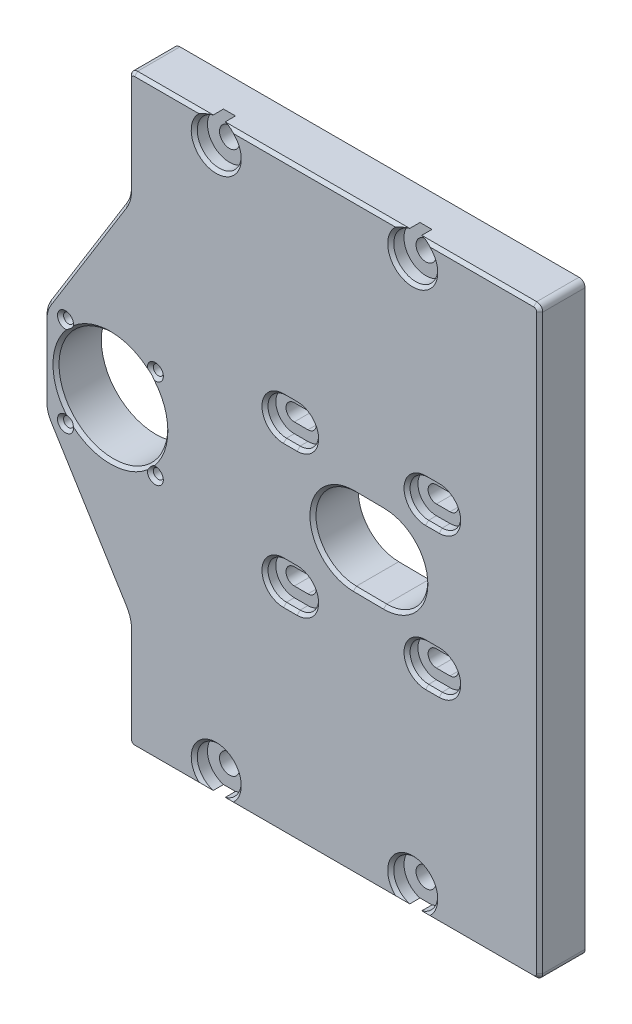
from build123d import *

# Parameters (mm, degrees)
SKETCH1_R                                = 18
BOSS_EXTRUDE1_DEPTH                      = 15
M4X0_7_TAPPED_HOLE1_D                    = 3.3
M4X0_7_TAPPED_HOLE1_DEPTH                = 19.008579979
M4X0_7_TAPPED_HOLE1_TIP                  = 0.991420021
CBORE_FOR_M6_HEX_HEAD_BOLT1_D            = 6.6
CBORE_FOR_M6_HEX_HEAD_BOLT1_DEPTH        = 28
CBORE_FOR_M6_HEX_HEAD_BOLT1_CBORE_D      = 14.55
CBORE_FOR_M6_HEX_HEAD_BOLT1_CBORE_DEPTH  = 4.38
CBORE_FOR_M6_HEX_HEAD_BOLT1_TIP          = 1.982840043
F_1_0MM_DOWEL_SLOT1_DEPTH                = 15
CBORE_SLOT_FOR_M5_HEX_HEAD_BOLT1_DEPTH   = 15
CBORE_START                              = 11.42
CBORE_SLOT_FOR_M5_HEX_HEAD_BOLT1_2_DEPTH = 3.58
FILLET1_R                                = 10
FILLET2_R                                = 2
CHAMFER1_SIZE                            = 1


# Read off the part's stored shape, not the designer's step: Ø1.0mm Dowel Slot1, CBORE SLOT for M5 Hex Head Bolt1
with BuildPart() as part:
    # Sketch1 → Boss-Extrude1 (new body)
    with BuildSketch(Plane.XY):
        Polygon((-148, 227), (-148, 190), (-176, 144.773286703), (-176, 115.226713297), (-148, 70), (-148, 33.5), (-12, 33.5), (-12, 227), align=None)
        with Locations((-154, 130)):
            Circle(SKETCH1_R, mode=Mode.SUBTRACT)
    extrude(amount=BOSS_EXTRUDE1_DEPTH)

    # M4x0.7 Tapped Hole1
    with Locations(Plane.XY.offset(15)):
        with Locations((-168.849242405, 144.849242405), (-139.150757595, 144.849242405), (-139.150757595, 115.150757595), (-168.849242405, 115.150757595)):
            Hole(M4X0_7_TAPPED_HOLE1_D / 2, depth=M4X0_7_TAPPED_HOLE1_DEPTH)
            with Locations((0, 0, -(M4X0_7_TAPPED_HOLE1_DEPTH + M4X0_7_TAPPED_HOLE1_TIP / 2))):  # 118° drill point
                Cone(0, M4X0_7_TAPPED_HOLE1_D / 2, M4X0_7_TAPPED_HOLE1_TIP, mode=Mode.SUBTRACT)

    # CBORE for M6 Hex Head Bolt1
    with Locations(Plane.XY.offset(15)):
        with Locations((-54, 220), (-119, 220), (-54, 40.5), (-119, 40.5)):
            CounterBoreHole(CBORE_FOR_M6_HEX_HEAD_BOLT1_D / 2, CBORE_FOR_M6_HEX_HEAD_BOLT1_CBORE_D / 2, CBORE_FOR_M6_HEX_HEAD_BOLT1_CBORE_DEPTH, depth=CBORE_FOR_M6_HEX_HEAD_BOLT1_DEPTH)
            with Locations((0, 0, -(CBORE_FOR_M6_HEX_HEAD_BOLT1_DEPTH + CBORE_FOR_M6_HEX_HEAD_BOLT1_TIP / 2))):  # 118° drill point
                Cone(0, CBORE_FOR_M6_HEX_HEAD_BOLT1_D / 2, CBORE_FOR_M6_HEX_HEAD_BOLT1_TIP, mode=Mode.SUBTRACT)

    # Ø1.0mm Dowel Slot1 outline → Ø1.0mm Dowel Slot1 (cut)
    with BuildSketch(Plane.XY):
        with BuildLine():
            Line((-73.630669903, 115.693008794), (-63.631140041, 115.596042148))
            ThreePointArc((-63.631140041, 115.596042148), (-50.000869755, 128.964502491), (-63.369330097, 142.594772777))
            Line((-63.369330097, 142.594772777), (-73.368859959, 142.691739423))
            ThreePointArc((-73.368859959, 142.691739423), (-86.999130245, 129.32327908), (-73.630669903, 115.693008794))
        make_face()
    extrude(amount=F_1_0MM_DOWEL_SLOT1_DEPTH, mode=Mode.SUBTRACT)

    # CBORE SLOT for M5 Hex Head Bolt1 outline → CBORE SLOT for M5 Hex Head Bolt1 (cut)
    with BuildSketch(Plane.XY):
        with BuildLine():
            Line((-49.75, 102.893890786), (-45.25, 102.893890786))
            ThreePointArc((-45.25, 102.893890786), (-42.5, 105.643890786), (-45.25, 108.393890786))
            Line((-45.25, 108.393890786), (-49.75, 108.393890786))
            ThreePointArc((-49.75, 108.393890786), (-52.5, 105.643890786), (-49.75, 102.893890786))
        make_face()
        with BuildLine():
            ThreePointArc((-92.25, 102.893890786), (-89.5, 105.643890786), (-92.25, 108.393890786))
            Line((-92.25, 108.393890786), (-96.75, 108.393890786))
            ThreePointArc((-96.75, 108.393890786), (-99.5, 105.643890786), (-96.75, 102.893890786))
            Line((-96.75, 102.893890786), (-92.25, 102.893890786))
        make_face()
        with BuildLine():
            Line((-49.75, 149.893890786), (-45.25, 149.893890786))
            ThreePointArc((-45.25, 149.893890786), (-42.5, 152.643890786), (-45.25, 155.393890786))
            Line((-45.25, 155.393890786), (-49.75, 155.393890786))
            ThreePointArc((-49.75, 155.393890786), (-52.5, 152.643890786), (-49.75, 149.893890786))
        make_face()
        with BuildLine():
            ThreePointArc((-92.25, 149.893890786), (-89.5, 152.643890786), (-92.25, 155.393890786))
            Line((-92.25, 155.393890786), (-96.75, 155.393890786))
            ThreePointArc((-96.75, 155.393890786), (-99.5, 152.643890786), (-96.75, 149.893890786))
            Line((-96.75, 149.893890786), (-92.25, 149.893890786))
        make_face()
    extrude(amount=CBORE_SLOT_FOR_M5_HEX_HEAD_BOLT1_DEPTH, mode=Mode.SUBTRACT)

    # CBORE SLOT for M5 Hex Head Bolt1 2 outli → CBORE SLOT for M5 Hex Head Bolt1 2 (cut)
    # profile 1 of 4: a face of its own
    with BuildSketch(Plane.XY.offset(CBORE_START)):
        with BuildLine():
            Line((-49.75, 99.523890786), (-45.25, 99.523890786))
            ThreePointArc((-45.25, 99.523890786), (-39.13, 105.643890786), (-45.25, 111.763890786))
            Line((-45.25, 111.763890786), (-49.75, 111.763890786))
            ThreePointArc((-49.75, 111.763890786), (-55.87, 105.643890786), (-49.75, 99.523890786))
        make_face()
        with BuildLine():
            ThreePointArc((-45.25, 108.393890786), (-42.5, 105.643890786), (-45.25, 102.893890786))
            Line((-45.25, 102.893890786), (-49.75, 102.893890786))
            ThreePointArc((-49.75, 102.893890786), (-52.5, 105.643890786), (-49.75, 108.393890786))
            Line((-49.75, 108.393890786), (-45.25, 108.393890786))
        make_face(mode=Mode.SUBTRACT)
    # profile 2 of 4: a face of its own
    with BuildSketch(Plane.XY.offset(CBORE_START)):
        with BuildLine():
            ThreePointArc((-92.25, 99.523890786), (-86.13, 105.643890786), (-92.25, 111.763890786))
            Line((-92.25, 111.763890786), (-96.75, 111.763890786))
            ThreePointArc((-96.75, 111.763890786), (-102.87, 105.643890786), (-96.75, 99.523890786))
            Line((-96.75, 99.523890786), (-92.25, 99.523890786))
        make_face()
        with BuildLine():
            Line((-96.75, 108.393890786), (-92.25, 108.393890786))
            ThreePointArc((-92.25, 108.393890786), (-89.5, 105.643890786), (-92.25, 102.893890786))
            Line((-92.25, 102.893890786), (-96.75, 102.893890786))
            ThreePointArc((-96.75, 102.893890786), (-99.5, 105.643890786), (-96.75, 108.393890786))
        make_face(mode=Mode.SUBTRACT)
    # profile 3 of 4: a face of its own
    with BuildSketch(Plane.XY.offset(CBORE_START)):
        with BuildLine():
            Line((-49.75, 146.523890786), (-45.25, 146.523890786))
            ThreePointArc((-45.25, 146.523890786), (-39.13, 152.643890786), (-45.25, 158.763890786))
            Line((-45.25, 158.763890786), (-49.75, 158.763890786))
            ThreePointArc((-49.75, 158.763890786), (-55.87, 152.643890786), (-49.75, 146.523890786))
        make_face()
        with BuildLine():
            ThreePointArc((-45.25, 155.393890786), (-42.5, 152.643890786), (-45.25, 149.893890786))
            Line((-45.25, 149.893890786), (-49.75, 149.893890786))
            ThreePointArc((-49.75, 149.893890786), (-52.5, 152.643890786), (-49.75, 155.393890786))
            Line((-49.75, 155.393890786), (-45.25, 155.393890786))
        make_face(mode=Mode.SUBTRACT)
    # profile 4 of 4: a face of its own
    with BuildSketch(Plane.XY.offset(CBORE_START)):
        with BuildLine():
            ThreePointArc((-92.25, 146.523890786), (-86.13, 152.643890786), (-92.25, 158.763890786))
            Line((-92.25, 158.763890786), (-96.75, 158.763890786))
            ThreePointArc((-96.75, 158.763890786), (-102.87, 152.643890786), (-96.75, 146.523890786))
            Line((-96.75, 146.523890786), (-92.25, 146.523890786))
        make_face()
        with BuildLine():
            Line((-96.75, 155.393890786), (-92.25, 155.393890786))
            ThreePointArc((-92.25, 155.393890786), (-89.5, 152.643890786), (-92.25, 149.893890786))
            Line((-92.25, 149.893890786), (-96.75, 149.893890786))
            ThreePointArc((-96.75, 149.893890786), (-99.5, 152.643890786), (-96.75, 155.393890786))
        make_face(mode=Mode.SUBTRACT)
    extrude(amount=CBORE_SLOT_FOR_M5_HEX_HEAD_BOLT1_2_DEPTH, mode=Mode.SUBTRACT)

    # Fillet1
    fillet1_edges = [part.edges().sort_by_distance(p)[0] for p in [
        (-148, 190, 7.5),
        (-148, 70, 7.5),
        (-176, 115.226713297, 7.5),
        (-176, 144.773286703, 7.5),
    ]]
    fillet(fillet1_edges, radius=FILLET1_R)

    # Fillet2
    fillet2_edges = [part.edges().sort_by_distance(p)[0] for p in [
        (-148, 227, 7.5),
        (-12, 227, 7.5),
        (-12, 33.5, 7.5),
        (-148, 33.5, 7.5),
    ]]
    fillet(fillet2_edges, radius=FILLET2_R)

    # Chamfer1
    # the kernel refuses this chamfer: 1 mm, written as the material it takes off along each edge
    with BuildSketch(Plane(origin=(-73.630669903, 115.693008794, 15), x_dir=(-0.009692998455511356, -0.9995749209290702, 0.027495876610585872), z_dir=(0.9999529862426669, -0.0096966646004136, 0)), Plane(origin=(-63.369330097, 142.594772777, 15), x_dir=(0.009692998455511349, 0.9995749209290702, 0.02749587661058549), z_dir=(-0.9999529862426669, 0.009696664600413593, 0))) as chamfer1_piece_1:
        Polygon((CHAMFER1_SIZE * 0.999621916911, CHAMFER1_SIZE * 0.0274958766106), (-CHAMFER1_SIZE * 0.0274958766106, CHAMFER1_SIZE * 0.999621916911), (0, 0), align=None)
    extrude(amount=10, mode=Mode.SUBTRACT)
    with BuildSketch(Plane(origin=(-63.50023507, 129.095407463, 15), x_dir=(-0.009696664555040242, -0.9999529862431069, 0), z_dir=(-0.9999529862431069, 0.009696664555040242, 0))) as chamfer1_piece_2:
        Polygon((13.5 + CHAMFER1_SIZE, 0), (13.5, -CHAMFER1_SIZE), (13.5, 0), align=None)
    revolve(axis=Axis((-63.50023507, 129.095407463, 15), (0, 0, 1)), revolution_arc=179.999999996, mode=Mode.SUBTRACT)
    with BuildSketch(Plane(origin=(-73.49976493, 129.192374108, 15), x_dir=(0.00969666455504077, 0.9999529862431069, 0), z_dir=(0.9999529862431069, -0.00969666455504077, 0))) as chamfer1_piece_3:
        Polygon((13.5 + CHAMFER1_SIZE, 0), (13.5, -CHAMFER1_SIZE), (13.5, 0), align=None)
    revolve(axis=Axis((-73.49976493, 129.192374108, 15), (0, 0, 1)), revolution_arc=179.999999996, mode=Mode.SUBTRACT)
    with BuildSketch(Plane(origin=(-49.75, 99.523890786, 15), x_dir=(0, -0.9996219169112968, 0.02749587661058574), z_dir=(1, 0, 0)), Plane(origin=(-45.25, 111.763890786, 15), x_dir=(0, 0.9996219169112968, 0.02749587661058574), z_dir=(-1, 0, 0)), Plane(origin=(-49.75, 146.523890786, 15), x_dir=(0, -0.9996219169112968, 0.02749587661058574), z_dir=(1, 0, 0)), Plane(origin=(-45.25, 158.763890786, 15), x_dir=(0, 0.9996219169112968, 0.02749587661058574), z_dir=(-1, 0, 0)), Plane(origin=(-96.75, 99.523890786, 15), x_dir=(0, -0.9996219169112968, 0.02749587661058574), z_dir=(1, 0, 0)), Plane(origin=(-92.25, 111.763890786, 15), x_dir=(0, 0.9996219169112968, 0.02749587661058574), z_dir=(-1, 0, 0)), Plane(origin=(-96.75, 146.523890786, 15), x_dir=(0, -0.9996219169112968, 0.02749587661058574), z_dir=(1, 0, 0)), Plane(origin=(-92.25, 158.763890786, 15), x_dir=(0, 0.9996219169112968, 0.02749587661058574), z_dir=(-1, 0, 0))) as chamfer1_piece_4:
        Polygon((CHAMFER1_SIZE * 0.999621916911, CHAMFER1_SIZE * 0.0274958766106), (-CHAMFER1_SIZE * 0.0274958766106, CHAMFER1_SIZE * 0.999621916911), (0, 0), align=None)
    extrude(amount=4.5, mode=Mode.SUBTRACT)
    with BuildSketch(Plane(origin=(-45.25, 105.643890786, 15), x_dir=(0, -1, 0), z_dir=(-1, 0, 0))) as chamfer1_piece_5:
        Polygon((6.12 + CHAMFER1_SIZE, 0), (6.12, -CHAMFER1_SIZE), (6.12, 0), align=None)
    revolve(axis=Axis((-45.25, 105.643890786, 15), (0, 0, 1)), revolution_arc=180, mode=Mode.SUBTRACT)
    with BuildSketch(Plane(origin=(-49.75, 105.643890786, 15), x_dir=(0, 1, 0), z_dir=(1, 0, 0))) as chamfer1_piece_6:
        Polygon((6.12 + CHAMFER1_SIZE, 0), (6.12, -CHAMFER1_SIZE), (6.12, 0), align=None)
    revolve(axis=Axis((-49.75, 105.643890786, 15), (0, 0, 1)), revolution_arc=180, mode=Mode.SUBTRACT)
    with BuildSketch(Plane(origin=(-45.25, 152.643890786, 15), x_dir=(0, -1, 0), z_dir=(-1, 0, 0))) as chamfer1_piece_7:
        Polygon((6.12 + CHAMFER1_SIZE, 0), (6.12, -CHAMFER1_SIZE), (6.12, 0), align=None)
    revolve(axis=Axis((-45.25, 152.643890786, 15), (0, 0, 1)), revolution_arc=180, mode=Mode.SUBTRACT)
    with BuildSketch(Plane(origin=(-49.75, 152.643890786, 15), x_dir=(0, 1, 0), z_dir=(1, 0, 0))) as chamfer1_piece_8:
        Polygon((6.12 + CHAMFER1_SIZE, 0), (6.12, -CHAMFER1_SIZE), (6.12, 0), align=None)
    revolve(axis=Axis((-49.75, 152.643890786, 15), (0, 0, 1)), revolution_arc=180, mode=Mode.SUBTRACT)
    with BuildSketch(Plane(origin=(-92.25, 105.643890786, 15), x_dir=(0, -1, 0), z_dir=(-1, 0, 0))) as chamfer1_piece_9:
        Polygon((6.12 + CHAMFER1_SIZE, 0), (6.12, -CHAMFER1_SIZE), (6.12, 0), align=None)
    revolve(axis=Axis((-92.25, 105.643890786, 15), (0, 0, 1)), revolution_arc=180, mode=Mode.SUBTRACT)
    with BuildSketch(Plane(origin=(-96.75, 105.643890786, 15), x_dir=(0, 1, 0), z_dir=(1, 0, 0))) as chamfer1_piece_10:
        Polygon((6.12 + CHAMFER1_SIZE, 0), (6.12, -CHAMFER1_SIZE), (6.12, 0), align=None)
    revolve(axis=Axis((-96.75, 105.643890786, 15), (0, 0, 1)), revolution_arc=180, mode=Mode.SUBTRACT)
    with BuildSketch(Plane(origin=(-92.25, 152.643890786, 15), x_dir=(0, -1, 0), z_dir=(-1, 0, 0))) as chamfer1_piece_11:
        Polygon((6.12 + CHAMFER1_SIZE, 0), (6.12, -CHAMFER1_SIZE), (6.12, 0), align=None)
    revolve(axis=Axis((-92.25, 152.643890786, 15), (0, 0, 1)), revolution_arc=180, mode=Mode.SUBTRACT)
    with BuildSketch(Plane(origin=(-154, 130, 15), x_dir=(1, 0, 0), z_dir=(0, -1, 0))) as chamfer1_piece_12:
        Polygon((18 + CHAMFER1_SIZE, 0), (18, -CHAMFER1_SIZE), (18, 0), align=None)
    revolve(axis=Axis((-154, 130, 15), (0, 0, 1)), mode=Mode.SUBTRACT)
    with BuildSketch(Plane(origin=(-96.75, 152.643890786, 15), x_dir=(0, 1, 0), z_dir=(1, 0, 0))) as chamfer1_piece_13:
        Polygon((6.12 + CHAMFER1_SIZE, 0), (6.12, -CHAMFER1_SIZE), (6.12, 0), align=None)
    revolve(axis=Axis((-96.75, 152.643890786, 15), (0, 0, 1)), revolution_arc=180, mode=Mode.SUBTRACT)
    with BuildSketch(Plane(origin=(-148, 67.155030725, 15), x_dir=(0.9996219169112968, 1.5567651322036354e-15, 0.02749587661058574), z_dir=(0, -1, 0))) as chamfer1_piece_14:
        Polygon((CHAMFER1_SIZE * 0.999621916911, -CHAMFER1_SIZE * 0.0274958766106), (-CHAMFER1_SIZE * 0.0274958766106, -CHAMFER1_SIZE * 0.999621916911), (0, 0), align=None)
    extrude(amount=31.655030725, mode=Mode.SUBTRACT)
    with BuildSketch(Plane(origin=(-174.50244021, 112.807795181, 15), x_dir=(0.8499225581401626, 0.5261897204753215, 0.027495876610587684), z_dir=(0.5263887391556802, -0.8502440210257837, 0)), Plane(origin=(-149.49755979, 187.581081884, 15), x_dir=(0.8499225581401512, -0.5261897204753404, 0.02749587661058793), z_dir=(-0.5263887391556991, -0.850244021025772, 0))) as chamfer1_piece_15:
        Polygon((CHAMFER1_SIZE * 0.999621916911, -CHAMFER1_SIZE * 0.0274958766106), (-CHAMFER1_SIZE * 0.0274958766106, -CHAMFER1_SIZE * 0.999621916911), (0, 0), align=None)
    extrude(amount=47.502688718, mode=Mode.SUBTRACT)
    with BuildSketch(Plane(origin=(-176, 141.928317427, 15), x_dir=(0.9996219169112968, 0, 0.02749587661058574), z_dir=(0, -1, 0))) as chamfer1_piece_16:
        Polygon((CHAMFER1_SIZE * 0.999621916911, -CHAMFER1_SIZE * 0.0274958766106), (-CHAMFER1_SIZE * 0.0274958766106, -CHAMFER1_SIZE * 0.999621916911), (0, 0), align=None)
    extrude(amount=23.856634855, mode=Mode.SUBTRACT)
    with BuildSketch(Plane(origin=(-166, 141.928317427, 15), x_dir=(-0.8502440210257728, 0.5263887391556976, 0), z_dir=(0.5263887391556976, 0.8502440210257728, 0))) as chamfer1_piece_17:
        Polygon((10 - CHAMFER1_SIZE, 0), (10, -CHAMFER1_SIZE), (10, 0), align=None)
    revolve(axis=Axis((-166, 141.928317427, 15), (0, 0, 1)), revolution_arc=31.761779622, mode=Mode.SUBTRACT)
    with BuildSketch(Plane(origin=(-166, 118.071682573, 15), x_dir=(-1, 0, 0), z_dir=(0, 1, 0))) as chamfer1_piece_18:
        Polygon((10 - CHAMFER1_SIZE, 0), (10, -CHAMFER1_SIZE), (10, 0), align=None)
    revolve(axis=Axis((-166, 118.071682573, 15), (0, 0, 1)), revolution_arc=31.761779622, mode=Mode.SUBTRACT)
    with BuildSketch(Plane(origin=(-158, 67.155030725, 15), x_dir=(0.8502440210257836, 0.5263887391556802, 0), z_dir=(-0.5263887391556802, 0.8502440210257836, 0))) as chamfer1_piece_19:
        Polygon((10 + CHAMFER1_SIZE, 0), (10, CHAMFER1_SIZE), (10, 0), align=None)
    revolve(axis=Axis((-158, 67.155030725, 15), (0, 0, -1)), revolution_arc=31.761779622, mode=Mode.SUBTRACT)
    with BuildSketch(Plane(origin=(-158, 192.844969275, 15), x_dir=(1, 0, 0), z_dir=(0, 1, 0))) as chamfer1_piece_20:
        Polygon((10, CHAMFER1_SIZE), (10 + CHAMFER1_SIZE, 0), (10, 0), align=None)
    revolve(axis=Axis((-158, 192.844969275, 15), (0, 0, -1)), revolution_arc=31.761779622, mode=Mode.SUBTRACT)
    with BuildSketch(Plane(origin=(-146, 33.5, 15), x_dir=(0, 0.9996219169112968, 0.02749587661058555), z_dir=(1, 0, 0)), Plane(origin=(-118.409636017, 227, 15), x_dir=(0, -0.9996219169112968, 0.02749587661058574), z_dir=(-1, 0, 0))) as chamfer1_piece_21:
        Polygon((CHAMFER1_SIZE * 0.999621916911, -CHAMFER1_SIZE * 0.0274958766106), (-CHAMFER1_SIZE * 0.0274958766106, -CHAMFER1_SIZE * 0.999621916911), (0, 0), align=None)
    extrude(amount=27.590363983, mode=Mode.SUBTRACT)
    with BuildSketch(Plane(origin=(-12, 35.5, 15), x_dir=(-0.9996219169112968, 0, 0.02749587661058579), z_dir=(0, 1, 0))) as chamfer1_piece_22:
        Polygon((CHAMFER1_SIZE * 0.999621916911, -CHAMFER1_SIZE * 0.0274958766106), (-CHAMFER1_SIZE * 0.0274958766106, -CHAMFER1_SIZE * 0.999621916911), (0, 0), align=None)
    extrude(amount=189.5, mode=Mode.SUBTRACT)
    with BuildSketch(Plane(origin=(-14, 227, 15), x_dir=(0, -0.9996219169112968, 0.02749587661058574), z_dir=(-1, 0, 0)), Plane(origin=(-54.590363983, 33.5, 15), x_dir=(0, 0.9996219169112968, 0.02749587661058555), z_dir=(1, 0, 0))) as chamfer1_piece_23:
        Polygon((CHAMFER1_SIZE * 0.999621916911, -CHAMFER1_SIZE * 0.0274958766106), (-CHAMFER1_SIZE * 0.0274958766106, -CHAMFER1_SIZE * 0.999621916911), (0, 0), align=None)
    extrude(amount=40.590363983, mode=Mode.SUBTRACT)
    with BuildSketch(Plane(origin=(-148, 225, 15), x_dir=(-0.0274958766105822, 0, -0.999621916911297), z_dir=(0, -1, 0))) as chamfer1_piece_24:
        Polygon((CHAMFER1_SIZE * 0.999621916911, CHAMFER1_SIZE * 0.0274958766106), (-CHAMFER1_SIZE * 0.0274958766106, CHAMFER1_SIZE * 0.999621916911), (0, 0), align=None)
    extrude(amount=32.155030725, mode=Mode.SUBTRACT)
    with BuildSketch(Plane(origin=(-146, 225, 15), x_dir=(-1, 0, 0), z_dir=(0, -1, 0))) as chamfer1_piece_25:
        Polygon((2, CHAMFER1_SIZE), (2 - CHAMFER1_SIZE, 0), (2, 0), align=None)
    revolve(axis=Axis((-146, 225, 15), (0, 0, -1)), revolution_arc=90, mode=Mode.SUBTRACT)
    with BuildSketch(Plane(origin=(-14, 225, 15), x_dir=(0, 1, 0), z_dir=(-1, 0, 0))) as chamfer1_piece_26:
        Polygon((2 - CHAMFER1_SIZE, 0), (2, CHAMFER1_SIZE), (2, 0), align=None)
    revolve(axis=Axis((-14, 225, 15), (0, 0, -1)), revolution_arc=90, mode=Mode.SUBTRACT)
    with BuildSketch(Plane(origin=(-14, 35.5, 15), x_dir=(1, 0, 0), z_dir=(0, 1, 0))) as chamfer1_piece_27:
        Polygon((2 - CHAMFER1_SIZE, 0), (2, CHAMFER1_SIZE), (2, 0), align=None)
    revolve(axis=Axis((-14, 35.5, 15), (0, 0, -1)), revolution_arc=90, mode=Mode.SUBTRACT)
    with BuildSketch(Plane(origin=(-146, 35.5, 15), x_dir=(0, -1, 0), z_dir=(1, 0, 0))) as chamfer1_piece_28:
        Polygon((2 - CHAMFER1_SIZE, 0), (2, CHAMFER1_SIZE), (2, 0), align=None)
    revolve(axis=Axis((-146, 35.5, 15), (0, 0, -1)), revolution_arc=90, mode=Mode.SUBTRACT)
    with BuildSketch(Plane(origin=(-168.849242405, 115.150757595, 15), x_dir=(-1, 0, 0), z_dir=(0, -1, 0))) as chamfer1_piece_29:
        Polygon((1.65 + CHAMFER1_SIZE, 0), (1.65, CHAMFER1_SIZE), (1.65, 0), align=None)
    revolve(axis=Axis((-168.849242405, 115.150757595, 15), (0, 0, -1)), mode=Mode.SUBTRACT)
    with BuildSketch(Plane(origin=(-139.150757595, 115.150757595, 15), x_dir=(-1, 0, 0), z_dir=(0, -1, 0))) as chamfer1_piece_30:
        Polygon((1.65 + CHAMFER1_SIZE, 0), (1.65, CHAMFER1_SIZE), (1.65, 0), align=None)
    revolve(axis=Axis((-139.150757595, 115.150757595, 15), (0, 0, -1)), mode=Mode.SUBTRACT)
    with BuildSketch(Plane(origin=(-139.150757595, 144.849242405, 15), x_dir=(-1, 0, 0), z_dir=(0, -1, 0))) as chamfer1_piece_31:
        Polygon((1.65 + CHAMFER1_SIZE, 0), (1.65, CHAMFER1_SIZE), (1.65, 0), align=None)
    revolve(axis=Axis((-139.150757595, 144.849242405, 15), (0, 0, -1)), mode=Mode.SUBTRACT)
    with BuildSketch(Plane(origin=(-168.849242405, 144.849242405, 15), x_dir=(-1, 0, 0), z_dir=(0, -1, 0))) as chamfer1_piece_32:
        Polygon((1.65 + CHAMFER1_SIZE, 0), (1.65, CHAMFER1_SIZE), (1.65, 0), align=None)
    revolve(axis=Axis((-168.849242405, 144.849242405, 15), (0, 0, -1)), mode=Mode.SUBTRACT)
    with BuildSketch(Plane(origin=(-119.590363983, 33.5, 15), x_dir=(0, 0.9996219169112968, 0.02749587661058555), z_dir=(1, 0, 0)), Plane(origin=(-53.409636017, 227, 15), x_dir=(0, -0.9996219169112968, 0.02749587661058574), z_dir=(-1, 0, 0))) as chamfer1_piece_33:
        Polygon((CHAMFER1_SIZE * 0.999621916911, -CHAMFER1_SIZE * 0.0274958766106), (-CHAMFER1_SIZE * 0.0274958766106, -CHAMFER1_SIZE * 0.999621916911), (0, 0), align=None)
    extrude(amount=66.180727966, mode=Mode.SUBTRACT)
    with BuildSketch(Plane(origin=(-119, 40.5, 15), x_dir=(-0.00314158748588091, -0.9999950652018581, 0), z_dir=(0.9999950652018581, -0.00314158748588091, 0))) as chamfer1_piece_34:
        Polygon((7.275 + CHAMFER1_SIZE, 0), (7.275, CHAMFER1_SIZE), (7.275, 0), align=None)
    revolve(axis=Axis((-119, 40.5, 15), (0, 0, -1)), revolution_arc=359.64, mode=Mode.SUBTRACT)
    with BuildSketch(Plane(origin=(-54, 40.5, 15), x_dir=(-0.00314158748588091, -0.9999950652018581, 0), z_dir=(0.9999950652018581, -0.00314158748588091, 0))) as chamfer1_piece_35:
        Polygon((7.275 + CHAMFER1_SIZE, 0), (7.275, CHAMFER1_SIZE), (7.275, 0), align=None)
    revolve(axis=Axis((-54, 40.5, 15), (0, 0, -1)), revolution_arc=359.64, mode=Mode.SUBTRACT)
    with BuildSketch(Plane(origin=(-119, 220, 15), x_dir=(0.003141587485878957, 0.9999950652018581, 0), z_dir=(-0.9999950652018581, 0.003141587485878957, 0))) as chamfer1_piece_36:
        Polygon((7.275 + CHAMFER1_SIZE, 0), (7.275, CHAMFER1_SIZE), (7.275, 0), align=None)
    revolve(axis=Axis((-119, 220, 15), (0, 0, -1)), revolution_arc=359.64, mode=Mode.SUBTRACT)
    with BuildSketch(Plane(origin=(-54, 220, 15), x_dir=(0.0031415874858799334, 0.9999950652018581, 0), z_dir=(-0.9999950652018581, 0.0031415874858799334, 0))) as chamfer1_piece_37:
        Polygon((7.275 + CHAMFER1_SIZE, 0), (7.275, CHAMFER1_SIZE), (7.275, 0), align=None)
    revolve(axis=Axis((-54, 220, 15), (0, 0, -1)), revolution_arc=359.64, mode=Mode.SUBTRACT)


solid = part.part
